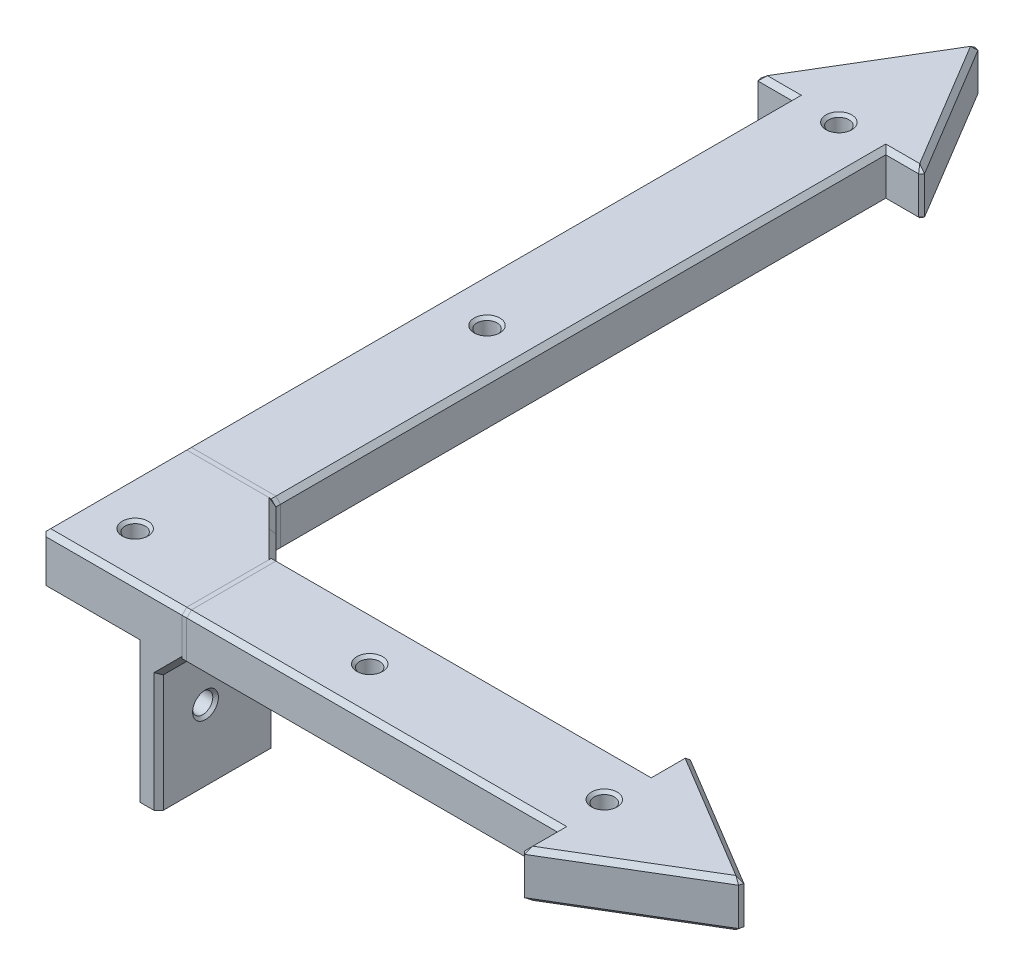
from build123d import *

# Parameters (mm, degrees)
BOSS_EXTRUDE1_DEPTH   = 10
SKETCH2_R             = 2.15
CUT_EXTRUDE1_DEPTH    = 223.261107709
BOSS_EXTRUDE5_DEPTH   = 10
BOSS_EXTRUDE6_DEPTH   = 30
SKETCH4_R             = 2.15
CUT_EXTRUDE2_DEPTH    = 217.10182785
SKETCH5_R             = 2.15
CUT_EXTRUDE3_DEPTH    = 219.403296678
SKETCH6_R             = 5
CUT_EXTRUDE4_DEPTH    = 6
CHAMFER1_SIZE         = 5
SKETCH9_W             = 20
SKETCH9_H             = 1
SKETCH9_W_2           = 1
SKETCH9_H_2           = 20
CUT_EXTRUDE5_DEPTH    = 226.610283454
SKETCH9_2_W           = 20
SKETCH9_2_H           = 1
BOSS_EXTRUDE7_DEPTH   = 10
SKETCH9_2_W_2         = 1
SKETCH9_2_H_2         = 20
BOSS_EXTRUDE7_2_DEPTH = 10
CHAMFER3_SIZE         = 1
CHAMFER4_SIZE         = 1
CHAMFER5_SIZE         = 1
CHAMFER7_SIZE         = 1
SKETCH10_R            = 5
CUT_EXTRUDE6_DEPTH    = 6
CHAMFER8_SIZE         = 1
CHAMFER9_SIZE         = 1
CHAMFER10_SIZE        = 0.6
CHAMFER11_SIZE        = 1
CHAMFER12_SIZE        = 1
CHAMFER13_SIZE        = 1
CHAMFER14_SIZE        = 1
CHAMFER15_SIZE        = 0.6
CHAMFER16_SIZE        = 0.6
CHAMFER17_SIZE        = 0.6


with BuildPart() as part:
    # Sketch1 → Boss-Extrude1 (new body)
    with BuildSketch(Plane(origin=(0, 0, 0), x_dir=(1, 0, 0), z_dir=(0, 1, 0))):
        Polygon((10, 150), (10, 10), (100, 10), (100, 18), (130, 0), (100, -18), (100, -10), (-10, -10), (-10, 150), (-18, 150), (0, 180), (18, 150), align=None)
    extrude(amount=BOSS_EXTRUDE1_DEPTH)

    # Sketch2 → Cut-Extrude1 (cut, through all)
    with BuildSketch(Plane(origin=(0, 10, 0), x_dir=(1, 0, 0), z_dir=(0, 1, 0))):
        with Locations(Location((0, 150, 0), (0, 0, 270))):
            Circle(SKETCH2_R)
        with Locations(Location((100, 0, 0), (0, 0, 270))):
            Circle(SKETCH2_R)
        with Locations(Location((0, 0, 0), (0, 0, 270))):
            Circle(SKETCH2_R)
        with Locations(Location((0, 75, 0), (0, 0, 270))):
            Circle(SKETCH2_R)
        with Locations(Location((50, 0, 0), (0, 0, 270))):
            Circle(SKETCH2_R)
    extrude(amount=-CUT_EXTRUDE1_DEPTH, mode=Mode.SUBTRACT)

    # Sketch3 → Boss-Extrude5 (add)
    with BuildSketch(Plane.XZ):
        Polygon((10, 10), (15, 10), (15, -15), (-10, -15), (-10, -10), (10, -10), align=None)
    extrude(amount=-BOSS_EXTRUDE5_DEPTH)

    # Sketch3<3> → Boss-Extrude6 (add)
    with BuildSketch(Plane.XZ):
        Polygon((10, 10), (15, 10), (15, -15), (-10, -15), (-10, -10), (10, -10), align=None)
    extrude(amount=BOSS_EXTRUDE6_DEPTH)

    # Sketch4 → Cut-Extrude2 (cut, through all)
    with BuildSketch(Plane.XY.offset(-10)):
        with Locations((0, -15)):
            Circle(SKETCH4_R)
    extrude(amount=-CUT_EXTRUDE2_DEPTH, mode=Mode.SUBTRACT)

    # Sketch5 → Cut-Extrude3 (cut, through all)
    with BuildSketch(Plane.ZY.offset(-10)):
        with Locations((0, -15)):
            Circle(SKETCH5_R)
    extrude(amount=-CUT_EXTRUDE3_DEPTH, mode=Mode.SUBTRACT)

    # Sketch6 → Cut-Extrude4 (cut)
    with BuildSketch(Plane.XZ):
        with Locations(Location((0, 0, 0), (0, 0, 270))):
            Circle(SKETCH6_R)
    extrude(amount=-CUT_EXTRUDE4_DEPTH, mode=Mode.SUBTRACT)

    # Chamfer1
    # the kernel refuses this chamfer: 5 mm, written as the material it adds along each edge
    with BuildSketch(Plane(origin=(10, 0, -15), x_dir=(0, 0.02749587661058634, -0.9996219169112968), z_dir=(-1, 0, 0))) as chamfer1_piece_1:
        Polygon((CHAMFER1_SIZE * 0.999621916911, CHAMFER1_SIZE * 0.0274958766106), (-CHAMFER1_SIZE * 0.0274958766106, CHAMFER1_SIZE * 0.999621916911), (0, 0), align=None)
    extrude(amount=20)
    with BuildSketch(Plane(origin=(10, 10, -15), x_dir=(-0.02749587661058631, 0, -0.9996219169112968), z_dir=(0, -1, 0))) as chamfer1_piece_2_section:
        Polygon((CHAMFER1_SIZE * 0.999621916911, CHAMFER1_SIZE * 0.0274958766106), (-CHAMFER1_SIZE * 0.0274958766106, CHAMFER1_SIZE * 0.999621916911), (0, 0), align=None)
    chamfer1_piece_2 = extrude(amount=10, mode=Mode.PRIVATE)
    chamfer1_piece_2 = split(chamfer1_piece_2, bisect_by=Plane(origin=(15, 5, -16.652020772), z_dir=(-1, 0, 0)), keep=Keep.TOP, mode=Mode.PRIVATE)
    add(chamfer1_piece_2)
    with BuildSketch(Plane(origin=(15, 0, -10), x_dir=(-0.02749587661058631, 0, -0.9996219169112968), z_dir=(0, 1, 0))) as chamfer1_piece_3_section:
        Polygon((CHAMFER1_SIZE * 0.999621916911, -CHAMFER1_SIZE * 0.0274958766106), (-CHAMFER1_SIZE * 0.0274958766106, -CHAMFER1_SIZE * 0.999621916911), (0, 0), align=None)
    chamfer1_piece_3 = extrude(amount=10, mode=Mode.PRIVATE)
    chamfer1_piece_3 = split(chamfer1_piece_3, bisect_by=Plane(origin=(16.652020772, 5, -15), z_dir=(0, 0, 1)), keep=Keep.TOP, mode=Mode.PRIVATE)
    add(chamfer1_piece_3)
    with BuildSketch(Plane(origin=(15, 0, 10), x_dir=(-0.027495876610586317, -0.9996219169112968, 0), z_dir=(0, 0, -1))) as chamfer1_piece_4:
        Polygon((CHAMFER1_SIZE * 0.999621916911, -CHAMFER1_SIZE * 0.0274958766106), (-CHAMFER1_SIZE * 0.0274958766106, -CHAMFER1_SIZE * 0.999621916911), (0, 0), align=None)
    extrude(amount=20)
    with BuildSketch(Plane(origin=(10, 10, -15), x_dir=(-0.02749587661058631, 0, -0.9996219169112968), z_dir=(0, -1, 0))) as chamfer1_piece_5a_section:
        Polygon((CHAMFER1_SIZE * 0.999621916911, CHAMFER1_SIZE * 0.0274958766106), (-CHAMFER1_SIZE * 0.0274958766106, CHAMFER1_SIZE * 0.999621916911), (0, 0), align=None)
    chamfer1_piece_5a = extrude(amount=22.85841494, mode=Mode.PRIVATE)
    chamfer1_piece_5a = split(chamfer1_piece_5a, bisect_by=Plane(origin=(11.643171669, 0, -16.652020772), z_dir=(0, -1, 0)), keep=Keep.TOP, mode=Mode.PRIVATE)
    chamfer1_piece_5a = split(chamfer1_piece_5a, bisect_by=Plane(origin=(15, -6.42920747, -16.652020772), z_dir=(-1, 0, 0)), keep=Keep.TOP, mode=Mode.PRIVATE)
    with BuildSketch(Plane(origin=(22.85841494, 0, -15), x_dir=(0, 0.027495876610586372, -0.9996219169112968), z_dir=(-1, 0, 0))) as chamfer1_piece_5b_section:
        Polygon((CHAMFER1_SIZE * 0.999621916911, CHAMFER1_SIZE * 0.0274958766106), (-CHAMFER1_SIZE * 0.0274958766106, CHAMFER1_SIZE * 0.999621916911), (0, 0), align=None)
    chamfer1_piece_5b = extrude(amount=32.85841494, mode=Mode.PRIVATE)
    chamfer1_piece_5b = split(chamfer1_piece_5b, bisect_by=Plane(origin=(10, -1.648968134, -16.648968134), z_dir=(1, 0, 0)), keep=Keep.TOP, mode=Mode.PRIVATE)
    chamfer1_piece_5b = split(chamfer1_piece_5b, bisect_by=Plane(origin=(15, -1.648968134, -16.648968134), z_dir=(-1, 0, 0)), keep=Keep.TOP, mode=Mode.PRIVATE)
    chamfer1_piece_5 = chamfer1_piece_5a & chamfer1_piece_5b
    add(chamfer1_piece_5)
    with BuildSketch(Plane(origin=(15, -12.85841494, -10), x_dir=(-0.027495876610586317, 0, -0.9996219169112968), z_dir=(0, 1, 0))) as chamfer1_piece_6a_section:
        Polygon((CHAMFER1_SIZE * 0.999621916911, -CHAMFER1_SIZE * 0.0274958766106), (-CHAMFER1_SIZE * 0.0274958766106, -CHAMFER1_SIZE * 0.999621916911), (0, 0), align=None)
    chamfer1_piece_6a = extrude(amount=22.85841494, mode=Mode.PRIVATE)
    chamfer1_piece_6a = split(chamfer1_piece_6a, bisect_by=Plane(origin=(16.652020772, -6.42920747, -15), z_dir=(0, 0, 1)), keep=Keep.TOP, mode=Mode.PRIVATE)
    chamfer1_piece_6a = split(chamfer1_piece_6a, bisect_by=Plane(origin=(16.652020772, 0, -11.643171669), z_dir=(0, -1, 0)), keep=Keep.TOP, mode=Mode.PRIVATE)
    with BuildSketch(Plane(origin=(15, 0, 10), x_dir=(-0.027495876610586317, -0.9996219169112968, 0), z_dir=(0, 0, -1))) as chamfer1_piece_6b_section:
        Polygon((CHAMFER1_SIZE * 0.999621916911, -CHAMFER1_SIZE * 0.0274958766106), (-CHAMFER1_SIZE * 0.0274958766106, -CHAMFER1_SIZE * 0.999621916911), (0, 0), align=None)
    chamfer1_piece_6b = extrude(amount=32.85841494, mode=Mode.PRIVATE)
    chamfer1_piece_6b = split(chamfer1_piece_6b, bisect_by=Plane(origin=(16.648968134, -1.648968134, -15), z_dir=(0, 0, 1)), keep=Keep.TOP, mode=Mode.PRIVATE)
    chamfer1_piece_6b = split(chamfer1_piece_6b, bisect_by=Plane(origin=(16.648968134, -1.648968134, -10), z_dir=(0, 0, -1)), keep=Keep.TOP, mode=Mode.PRIVATE)
    chamfer1_piece_6 = chamfer1_piece_6a & chamfer1_piece_6b
    add(chamfer1_piece_6)

    # Sketch9 → Cut-Extrude5 (cut, through all)
    with BuildSketch(Plane(origin=(0, 10, 0), x_dir=(1, 0, 0), z_dir=(0, 1, 0))):
        with Locations((0, 20.5)):
            Rectangle(SKETCH9_W, SKETCH9_H)
        with Locations((20.5, 0)):
            Rectangle(SKETCH9_W_2, SKETCH9_H_2)
    extrude(amount=-CUT_EXTRUDE5_DEPTH, mode=Mode.SUBTRACT)


with BuildPart() as cut_extrude5_piece_1:
    # of the separate pieces the step leaves, piece 1, a body of its own (cut_extrude5_pieces)
    add(part.part.solids().sort_by_distance((10, 0, -150))[0])

    # Chamfer2
    # the kernel refuses this chamfer: 1, 0.739130435, 0.728868987 mm, written as the material it takes off along each edge
    with BuildSketch(Plane(origin=(-16.99681496, 9.333333333, -150.619164309), x_dir=(-0.7782088562567454, -0.6217242142135965, 0.08860009878128813), z_dir=(-0.6063729082177826, 0.7805968163467781, 0.15159322705445322))) as chamfer2_piece_1:
        Polygon((-1.042002401, -0.293067246), (0.566427795, -0.293067246), (0.475574606, 0.586134493), align=None)
    extrude(amount=1.344819546, mode=Mode.SUBTRACT)
    with BuildSketch(Plane(origin=(0.044738761, 9.333333333, -178.855019108), x_dir=(0.32907259085720125, -0.6396021490668314, -0.6947088029207775), z_dir=(0.15691973428976674, 0.7624928516630223, -0.627678937159135))) as chamfer2_piece_2:
        Polygon((-0.995966631, -0.303924041), (0.567505288, -0.303924041), (0.428461343, 0.607848083), align=None)
    extrude(amount=1.341987419, mode=Mode.SUBTRACT)
    with BuildSketch(Plane(origin=(-16.99681496, 0.666666667, -150.619164309), x_dir=(-0.7782088562567492, 0.6217242142135969, 0.08860009878125295), z_dir=(-0.6063729082177852, -0.780596816346776, 0.15159322705445313))) as chamfer2_piece_3:
        Polygon((-1.042002401, 0.293067246), (0.566427795, 0.293067246), (0.475574606, -0.586134493), align=None)
    extrude(amount=1.344819546, mode=Mode.SUBTRACT)
    with BuildSketch(Plane(origin=(0.044738761, 0.666666667, -178.855019108), x_dir=(0.32907259085719187, 0.6396021490668234, -0.6947088029207894), z_dir=(0.15691973428976302, -0.7624928516630299, -0.6276789371591265))) as chamfer2_piece_4:
        Polygon((-0.995966631, 0.303924041), (0.567505288, 0.303924041), (0.428461343, -0.607848083), align=None)
    extrude(amount=1.341987419, mode=Mode.SUBTRACT)
    with BuildSketch(Plane(origin=(16.95293654, 0.666666667, -150.541666667), x_dir=(-0.4763591113025611, -0.621724214213599, -0.6217242142135991), z_dir=(0.4419664072694202, -0.7805968163467748, 0.4419664072694219))) as chamfer2_piece_5:
        Polygon((-0.566427795, -0.293067246), (1.042002401, -0.293067246), (-0.475574606, 0.586134493), align=None)
    extrude(amount=1.344819546, mode=Mode.SUBTRACT)
    with BuildSketch(Plane(origin=(16.95293654, 9.333333333, -150.541666667), x_dir=(-0.47635911130255404, 0.6217242142135928, -0.6217242142136105), z_dir=(0.4419664072694172, 0.780596816346779, 0.4419664072694175))) as chamfer2_piece_6:
        Polygon((-0.566427795, 0.293067246), (1.042002401, 0.293067246), (-0.475574606, -0.586134493), align=None)
    extrude(amount=1.344819546, mode=Mode.SUBTRACT)
    with BuildSketch(Plane(origin=(-19.323119982, 10, -147.794800031), x_dir=(0.8571687221386496, 0.027495876610585782, 0.5143012332831899), z_dir=(0.5144957554275266, 0, -0.8574929257125442)), Plane(origin=(-1.323119982, 10, -182.205199969), x_dir=(-0.8571687221386496, 0.027495876610585723, 0.5143012332831898), z_dir=(0.5144957554275266, 0, 0.8574929257125442))) as chamfer2_piece_7:
        with BuildLine():
            Line((1.028673195, 0), (-0.056547155, 1.027117794))
            Line((-0.056547155, 1.027117794), (-0.076539593, 1.026567876))
            ThreePointArc((-0.076539593, 1.026567876), (-0.034129227, 0.51339783), (-0.019992438, -0.000549918))
            Line((-0.019992438, -0.000549918), (0.000549918, -0.019992438))
            ThreePointArc((0.000549918, -0.019992438), (0.514497665, -0.00585565), (1.029223113, -0.019992438))
            Line((1.029223113, -0.019992438), (1.028673195, 0))
        make_face()
    extrude(amount=40.129077345, mode=Mode.SUBTRACT)
    with BuildSketch(Plane(origin=(-10, 0, -18.428317012), x_dir=(0.9996219169112968, -0.027495876610586355, 0), z_dir=(0, 0, -1)), Plane(origin=(10, 10, -150), x_dir=(0.02749587661058574, -0.9996219169112968, 0), z_dir=(0, 0, 1)), Plane(origin=(-10, 10, -150), x_dir=(0.9996219169112968, 0.027495876610585647, 0), z_dir=(0, 0, 1))) as chamfer2_piece_8:
        with BuildLine():
            Line((1.028673195, 0), (-0.056547155, -1.027117794))
            Line((-0.056547155, -1.027117794), (-0.076539593, -1.026567876))
            ThreePointArc((-0.076539593, -1.026567876), (-0.034129227, -0.51339783), (-0.019992438, 0.000549918))
            Line((-0.019992438, 0.000549918), (0.000549918, 0.019992438))
            ThreePointArc((0.000549918, 0.019992438), (0.514497665, 0.00585565), (1.029223113, 0.019992438))
            Line((1.029223113, 0.019992438), (1.028673195, 0))
        make_face()
    extrude(amount=131.571682988, mode=Mode.SUBTRACT)
    with BuildSketch(Plane(origin=(-10, 0, -150), x_dir=(0, -0.027495876610586483, -0.9996219169112968), z_dir=(-1, 0, 0)), Plane(origin=(20.571682988, 10, -150), x_dir=(0, -0.999621916911297, 0.0274958766105822), z_dir=(-1, 0, 0))) as chamfer2_piece_9:
        with BuildLine():
            Line((1.028673195, 0), (-0.056547155, -1.027117794))
            Line((-0.056547155, -1.027117794), (-0.076539593, -1.026567876))
            ThreePointArc((-0.076539593, -1.026567876), (-0.034129227, -0.51339783), (-0.019992438, 0.000549918))
            Line((-0.019992438, 0.000549918), (0.000549918, 0.019992438))
            ThreePointArc((0.000549918, 0.019992438), (0.514497665, 0.00585565), (1.029223113, 0.019992438))
            Line((1.029223113, 0.019992438), (1.028673195, 0))
        make_face()
    extrude(amount=10.571682988, mode=Mode.SUBTRACT)
    with BuildSketch(Plane(origin=(-19.323119982, 0, -147.794800031), x_dir=(0.8571687221386495, -0.027495876610586, 0.5143012332831898), z_dir=(0.5144957554275266, 0, -0.8574929257125442)), Plane(origin=(-1.323119982, 0, -182.205199969), x_dir=(-0.8571687221386497, -0.02749587661058593, 0.5143012332831898), z_dir=(0.5144957554275266, 0, 0.8574929257125442))) as chamfer2_piece_10:
        with BuildLine():
            Line((1.028673195, 0), (-0.056547155, -1.027117794))
            Line((-0.056547155, -1.027117794), (-0.076539593, -1.026567876))
            ThreePointArc((-0.076539593, -1.026567876), (-0.034129227, -0.51339783), (-0.019992438, 0.000549918))
            Line((-0.019992438, 0.000549918), (0.000549918, 0.019992438))
            ThreePointArc((0.000549918, 0.019992438), (0.514497665, 0.00585565), (1.029223113, 0.019992438))
            Line((1.029223113, 0.019992438), (1.028673195, 0))
        make_face()
    extrude(amount=40.129077345, mode=Mode.SUBTRACT)
    with BuildSketch(Plane(origin=(10, 0, -150), x_dir=(0.0274958766105856, 0.9996219169112968, 0), z_dir=(0, 0, 1))) as chamfer2_piece_11:
        with BuildLine():
            Line((1.028673195, 0), (-0.056547155, 1.027117794))
            Line((-0.056547155, 1.027117794), (-0.076539593, 1.026567876))
            ThreePointArc((-0.076539593, 1.026567876), (-0.034129227, 0.51339783), (-0.019992438, -0.000549918))
            Line((-0.019992438, -0.000549918), (0.000549918, -0.019992438))
            ThreePointArc((0.000549918, -0.019992438), (0.514497665, -0.00585565), (1.029223113, -0.019992438))
            Line((1.029223113, -0.019992438), (1.028673195, 0))
        make_face()
    extrude(amount=131.571682988, mode=Mode.SUBTRACT)
    with BuildSketch(Plane(origin=(20.571682988, 0, -150), x_dir=(0, 0.999621916911297, 0.02749587661058218), z_dir=(-1, 0, 0)), Plane(origin=(-10, 10, -150), x_dir=(0, 0.02749587661058422, -0.9996219169112968), z_dir=(-1, 0, 0))) as chamfer2_piece_12:
        with BuildLine():
            Line((1.028673195, 0), (-0.056547155, 1.027117794))
            Line((-0.056547155, 1.027117794), (-0.076539593, 1.026567876))
            ThreePointArc((-0.076539593, 1.026567876), (-0.034129227, 0.51339783), (-0.019992438, -0.000549918))
            Line((-0.019992438, -0.000549918), (0.000549918, -0.019992438))
            ThreePointArc((0.000549918, -0.019992438), (0.514497665, -0.00585565), (1.029223113, -0.019992438))
            Line((1.029223113, -0.019992438), (1.028673195, 0))
        make_face()
    extrude(amount=10.571682988, mode=Mode.SUBTRACT)
    with BuildSketch(Plane(origin=(-18, -2.571682988, -150), x_dir=(0.49072371360334666, 0, -0.8713152339465554), z_dir=(0, 1, 0)), Plane(origin=(18, -2.571682988, -150), x_dir=(-0.999621916911297, 0, 0.0274958766105822), z_dir=(0, 1, 0))) as chamfer2_piece_13:
        with BuildLine():
            Line((1.028673195, 0), (0.328622018, -0.662570528))
            Line((0.328622018, -0.662570528), (0.311195713, -0.672385003))
            ThreePointArc((0.311195713, -0.672385003), (0.163790703, -0.3315783), (-0.017426305, -0.009814474))
            Line((-0.017426305, -0.009814474), (0.000549918, 0.019992438))
            ThreePointArc((0.000549918, 0.019992438), (0.514497665, 0.00585565), (1.029223113, 0.019992438))
            Line((1.029223113, 0.019992438), (1.028673195, 0))
        make_face()
    extrude(amount=15.143365976, mode=Mode.SUBTRACT)
    with BuildSketch(Plane(origin=(0, -2.571682988, -180), x_dir=(0.5378787529630349, 0, 0.8430222103307425), z_dir=(0, 1, 0))) as chamfer2_piece_14:
        with BuildLine():
            Line((1.028673195, 0), (0.300711208, -0.688986997))
            Line((0.300711208, -0.688986997), (0.282812037, -0.697909982))
            ThreePointArc((0.282812037, -0.697909982), (0.149580102, -0.344880097), (-0.017899171, -0.008922985))
            Line((-0.017899171, -0.008922985), (0.000549918, 0.019992438))
            ThreePointArc((0.000549918, 0.019992438), (0.514497665, 0.00585565), (1.029223113, 0.019992438))
            Line((1.029223113, 0.019992438), (1.028673195, 0))
        make_face()
    extrude(amount=15.143365976, mode=Mode.SUBTRACT)
    with BuildSketch(Plane(origin=(-7.428317012, 0, -150), x_dir=(0, -0.027495876610586483, -0.9996219169112968), z_dir=(-1, 0, 0))) as chamfer2_piece_15a_section:
        with BuildLine():
            Line((1.028673195, 0), (-0.056547155, -1.027117794))
            Line((-0.056547155, -1.027117794), (-0.076539593, -1.026567876))
            ThreePointArc((-0.076539593, -1.026567876), (-0.034129227, -0.51339783), (-0.019992438, 0.000549918))
            Line((-0.019992438, 0.000549918), (0.000549918, 0.019992438))
            ThreePointArc((0.000549918, 0.019992438), (0.514497665, 0.00585565), (1.029223113, 0.019992438))
            Line((1.029223113, 0.019992438), (1.028673195, 0))
        make_face()
    chamfer2_piece_15a = extrude(amount=13.143365976, mode=Mode.PRIVATE)
    chamfer2_piece_15a = split(chamfer2_piece_15a, bisect_by=Plane(origin=(-10, 0.329793627, -150.329793627), z_dir=(1, 0, 0)), keep=Keep.TOP, mode=Mode.PRIVATE)
    with BuildSketch(Plane(origin=(-10, 0, -18.428317012), x_dir=(0.9996219169112968, -0.027495876610586355, 0), z_dir=(0, 0, -1))) as chamfer2_piece_15b_section:
        with BuildLine():
            Line((1.028673195, 0), (-0.056547155, -1.027117794))
            Line((-0.056547155, -1.027117794), (-0.076539593, -1.026567876))
            ThreePointArc((-0.076539593, -1.026567876), (-0.034129227, -0.51339783), (-0.019992438, 0.000549918))
            Line((-0.019992438, 0.000549918), (0.000549918, 0.019992438))
            ThreePointArc((0.000549918, 0.019992438), (0.514497665, 0.00585565), (1.029223113, 0.019992438))
            Line((1.029223113, 0.019992438), (1.028673195, 0))
        make_face()
    chamfer2_piece_15b = extrude(amount=134.143365976, mode=Mode.PRIVATE)
    chamfer2_piece_15b = split(chamfer2_piece_15b, bisect_by=Plane(origin=(-9.670206373, 0.329793627, -150), z_dir=(0, 0, -1)), keep=Keep.TOP, mode=Mode.PRIVATE)
    chamfer2_piece_15 = chamfer2_piece_15a & chamfer2_piece_15b
    add(chamfer2_piece_15, mode=Mode.SUBTRACT)
    with BuildSketch(Plane(origin=(10, 10, -152.571682988), x_dir=(0.02749587661058574, -0.9996219169112968, 0), z_dir=(0, 0, 1))) as chamfer2_piece_16a_section:
        with BuildLine():
            Line((1.028673195, 0), (-0.056547155, -1.027117794))
            Line((-0.056547155, -1.027117794), (-0.076539593, -1.026567876))
            ThreePointArc((-0.076539593, -1.026567876), (-0.034129227, -0.51339783), (-0.019992438, 0.000549918))
            Line((-0.019992438, 0.000549918), (0.000549918, 0.019992438))
            ThreePointArc((0.000549918, 0.019992438), (0.514497665, 0.00585565), (1.029223113, 0.019992438))
            Line((1.029223113, 0.019992438), (1.028673195, 0))
        make_face()
    chamfer2_piece_16a = extrude(amount=134.143365976, mode=Mode.PRIVATE)
    chamfer2_piece_16a = split(chamfer2_piece_16a, bisect_by=Plane(origin=(9.670206373, 9.670206373, -150), z_dir=(0, 0, -1)), keep=Keep.TOP, mode=Mode.PRIVATE)
    with BuildSketch(Plane(origin=(20.571682988, 10, -150), x_dir=(0, -0.999621916911297, 0.0274958766105822), z_dir=(-1, 0, 0))) as chamfer2_piece_16b_section:
        with BuildLine():
            Line((1.028673195, 0), (-0.056547155, -1.027117794))
            Line((-0.056547155, -1.027117794), (-0.076539593, -1.026567876))
            ThreePointArc((-0.076539593, -1.026567876), (-0.034129227, -0.51339783), (-0.019992438, 0.000549918))
            Line((-0.019992438, 0.000549918), (0.000549918, 0.019992438))
            ThreePointArc((0.000549918, 0.019992438), (0.514497665, 0.00585565), (1.029223113, 0.019992438))
            Line((1.029223113, 0.019992438), (1.028673195, 0))
        make_face()
    chamfer2_piece_16b = extrude(amount=13.143365976, mode=Mode.PRIVATE)
    chamfer2_piece_16b = split(chamfer2_piece_16b, bisect_by=Plane(origin=(10, 9.670206373, -150.329793627), z_dir=(-1, 0, 0)), keep=Keep.TOP, mode=Mode.PRIVATE)
    chamfer2_piece_16 = chamfer2_piece_16a & chamfer2_piece_16b
    add(chamfer2_piece_16, mode=Mode.SUBTRACT)
    with BuildSketch(Plane(origin=(10, 0, -152.571682988), x_dir=(0.027495876610585623, 0.9996219169112968, 0), z_dir=(0, 0, 1))) as chamfer2_piece_17a_section:
        with BuildLine():
            Line((1.028673195, 0), (-0.056547155, 1.027117794))
            Line((-0.056547155, 1.027117794), (-0.076539593, 1.026567876))
            ThreePointArc((-0.076539593, 1.026567876), (-0.034129227, 0.51339783), (-0.019992438, -0.000549918))
            Line((-0.019992438, -0.000549918), (0.000549918, -0.019992438))
            ThreePointArc((0.000549918, -0.019992438), (0.514497665, -0.00585565), (1.029223113, -0.019992438))
            Line((1.029223113, -0.019992438), (1.028673195, 0))
        make_face()
    chamfer2_piece_17a = extrude(amount=134.143365976, mode=Mode.PRIVATE)
    chamfer2_piece_17a = split(chamfer2_piece_17a, bisect_by=Plane(origin=(9.670206373, 0.329793627, -150), z_dir=(0, 0, -1)), keep=Keep.TOP, mode=Mode.PRIVATE)
    with BuildSketch(Plane(origin=(20.571682988, 0, -150), x_dir=(0, 0.999621916911297, 0.02749587661058218), z_dir=(-1, 0, 0))) as chamfer2_piece_17b_section:
        with BuildLine():
            Line((1.028673195, 0), (-0.056547155, 1.027117794))
            Line((-0.056547155, 1.027117794), (-0.076539593, 1.026567876))
            ThreePointArc((-0.076539593, 1.026567876), (-0.034129227, 0.51339783), (-0.019992438, -0.000549918))
            Line((-0.019992438, -0.000549918), (0.000549918, -0.019992438))
            ThreePointArc((0.000549918, -0.019992438), (0.514497665, -0.00585565), (1.029223113, -0.019992438))
            Line((1.029223113, -0.019992438), (1.028673195, 0))
        make_face()
    chamfer2_piece_17b = extrude(amount=13.143365976, mode=Mode.PRIVATE)
    chamfer2_piece_17b = split(chamfer2_piece_17b, bisect_by=Plane(origin=(10, 0.329793627, -150.329793627), z_dir=(-1, 0, 0)), keep=Keep.TOP, mode=Mode.PRIVATE)
    chamfer2_piece_17 = chamfer2_piece_17a & chamfer2_piece_17b
    add(chamfer2_piece_17, mode=Mode.SUBTRACT)
    with BuildSketch(Plane(origin=(-7.428317012, 10, -150), x_dir=(0, 0.02749587661058422, -0.9996219169112968), z_dir=(-1, 0, 0))) as chamfer2_piece_18a_section:
        with BuildLine():
            Line((1.028673195, 0), (-0.056547155, 1.027117794))
            Line((-0.056547155, 1.027117794), (-0.076539593, 1.026567876))
            ThreePointArc((-0.076539593, 1.026567876), (-0.034129227, 0.51339783), (-0.019992438, -0.000549918))
            Line((-0.019992438, -0.000549918), (0.000549918, -0.019992438))
            ThreePointArc((0.000549918, -0.019992438), (0.514497665, -0.00585565), (1.029223113, -0.019992438))
            Line((1.029223113, -0.019992438), (1.028673195, 0))
        make_face()
    chamfer2_piece_18a = extrude(amount=13.143365976, mode=Mode.PRIVATE)
    chamfer2_piece_18a = split(chamfer2_piece_18a, bisect_by=Plane(origin=(-10, 9.670206373, -150.329793627), z_dir=(1, 0, 0)), keep=Keep.TOP, mode=Mode.PRIVATE)
    with BuildSketch(Plane(origin=(-10, 10, -152.571682988), x_dir=(0.9996219169112968, 0.02749587661058574, 0), z_dir=(0, 0, 1))) as chamfer2_piece_18b_section:
        with BuildLine():
            Line((1.028673195, 0), (-0.056547155, -1.027117794))
            Line((-0.056547155, -1.027117794), (-0.076539593, -1.026567876))
            ThreePointArc((-0.076539593, -1.026567876), (-0.034129227, -0.51339783), (-0.019992438, 0.000549918))
            Line((-0.019992438, 0.000549918), (0.000549918, 0.019992438))
            ThreePointArc((0.000549918, 0.019992438), (0.514497665, 0.00585565), (1.029223113, 0.019992438))
            Line((1.029223113, 0.019992438), (1.028673195, 0))
        make_face()
    chamfer2_piece_18b = extrude(amount=134.143365976, mode=Mode.PRIVATE)
    chamfer2_piece_18b = split(chamfer2_piece_18b, bisect_by=Plane(origin=(-9.670206373, 9.670206373, -150), z_dir=(0, 0, -1)), keep=Keep.TOP, mode=Mode.PRIVATE)
    chamfer2_piece_18 = chamfer2_piece_18a & chamfer2_piece_18b
    add(chamfer2_piece_18, mode=Mode.SUBTRACT)


with BuildPart() as cut_extrude5_piece_2:
    # of the separate pieces the step leaves, piece 2, a body of its own (cut_extrude5_pieces)
    add(part.part.solids().sort_by_distance((21, 0, -10))[0])

    # Chamfer6
    # the kernel refuses this chamfer: 1, 0.739130435, 0.728868987 mm, written as the material it takes off along each edge
    with BuildSketch(Plane(origin=(100.619164309, 0.666666667, -16.99681496), x_dir=(0.08860009878125359, -0.621724214213601, 0.7782088562567459), z_dir=(-0.15159322705444028, -0.7805968163467738, -0.6063729082177913))) as chamfer6_piece_1:
        Polygon((-0.566427795, -0.293067246), (1.042002401, -0.293067246), (-0.475574606, 0.586134493), align=None)
    extrude(amount=1.344819546, mode=Mode.SUBTRACT)
    with BuildSketch(Plane(origin=(128.855019108, 0.666666667, 0.044738761), x_dir=(-0.7744876408886496, -0.5912789605787493, 0.22485125058057331), z_dir=(0.6276789371591284, -0.7624928516630249, 0.1569197342897806))) as chamfer6_piece_2:
        Polygon((-0.688562834, 0.280961988), (1.00268625, 0.280961988), (-0.314123416, -0.561923976), align=None)
    extrude(amount=1.341987419, mode=Mode.SUBTRACT)
    with BuildSketch(Plane(origin=(100.541666667, 0.666666667, 16.95293654), x_dir=(-0.6217242142136105, 0.6217242142135928, 0.47635911130255404), z_dir=(-0.44196640726941855, -0.7805968163467791, 0.441966407269416))) as chamfer6_piece_3:
        Polygon((-1.042002401, 0.293067246), (0.566427795, 0.293067246), (0.475574606, -0.586134493), align=None)
    extrude(amount=1.344819546, mode=Mode.SUBTRACT)
    with BuildSketch(Plane(origin=(100.541666667, 9.333333333, 16.95293654), x_dir=(-0.6217242142136105, -0.6217242142135928, 0.47635911130255404), z_dir=(-0.44196640726941855, 0.7805968163467791, 0.441966407269416))) as chamfer6_piece_4:
        Polygon((-1.042002401, -0.293067246), (0.566427795, -0.293067246), (0.475574606, 0.586134493), align=None)
    extrude(amount=1.344819546, mode=Mode.SUBTRACT)
    with BuildSketch(Plane(origin=(128.855019108, 9.333333333, 0.044738761), x_dir=(-0.7744876408886497, 0.5912789605787492, 0.22485125058057354), z_dir=(0.6276789371591281, 0.7624928516630249, 0.15691973428978054))) as chamfer6_piece_5:
        Polygon((-0.688562834, -0.280961988), (1.00268625, -0.280961988), (-0.314123416, 0.561923976), align=None)
    extrude(amount=1.341987419, mode=Mode.SUBTRACT)
    with BuildSketch(Plane(origin=(100.619164309, 9.333333333, -16.99681496), x_dir=(-0.9701425001453348, 0, 0.24253562503632162), z_dir=(-0.15159322705444056, 0.7805968163467729, -0.6063729082177924))) as chamfer6_piece_6:
        Polygon((-0.349737282, -0.533303565), (0.534146195, -0.533303565), (-0.184408913, 1.066607129), align=None)
    extrude(amount=1.344819546, mode=Mode.SUBTRACT)
    with BuildSketch(Plane(origin=(100, 0, -10), x_dir=(0.9996219169112968, -0.027495876610586483, 0), z_dir=(0, 0, -1)), Plane(origin=(100, 0, 20.571682988), x_dir=(0.9996219169112968, -0.027495876610585335, 0), z_dir=(0, 0, -1)), Plane(origin=(100, 10, -10), x_dir=(-0.0274958766105822, -0.999621916911297, 0), z_dir=(0, 0, -1))) as chamfer6_piece_7:
        with BuildLine():
            Line((1.028673195, 0), (-0.056547155, -1.027117794))
            Line((-0.056547155, -1.027117794), (-0.076539593, -1.026567876))
            ThreePointArc((-0.076539593, -1.026567876), (-0.034129227, -0.51339783), (-0.019992438, 0.000549918))
            Line((-0.019992438, 0.000549918), (0.000549918, 0.019992438))
            ThreePointArc((0.000549918, 0.019992438), (0.514497665, 0.00585565), (1.029223113, 0.019992438))
            Line((1.029223113, 0.019992438), (1.028673195, 0))
        make_face()
    extrude(amount=10.571682988, mode=Mode.SUBTRACT)
    with BuildSketch(Plane(origin=(97.794800031, 0, -19.323119982), x_dir=(-0.5143012332831898, -0.027495876610586768, 0.8571687221386495), z_dir=(0.8574929257125442, 0, 0.5144957554275266)), Plane(origin=(132.205199969, 0, -1.323119982), x_dir=(-0.5143012332831898, -0.027495876610586785, -0.8571687221386495), z_dir=(-0.8574929257125442, 0, 0.5144957554275266))) as chamfer6_piece_8:
        with BuildLine():
            Line((1.028673195, 0), (-0.056547155, -1.027117794))
            Line((-0.056547155, -1.027117794), (-0.076539593, -1.026567876))
            ThreePointArc((-0.076539593, -1.026567876), (-0.034129227, -0.51339783), (-0.019992438, 0.000549918))
            Line((-0.019992438, 0.000549918), (0.000549918, 0.019992438))
            ThreePointArc((0.000549918, 0.019992438), (0.514497665, 0.00585565), (1.029223113, 0.019992438))
            Line((1.029223113, 0.019992438), (1.028673195, 0))
        make_face()
    extrude(amount=40.129077345, mode=Mode.SUBTRACT)
    with BuildSketch(Plane(origin=(18.428317012, 10, 10), x_dir=(0, 0.027495876610585838, -0.9996219169112968), z_dir=(1, 0, 0)), Plane(origin=(18.428317012, 10, -10), x_dir=(0, -0.9996219169112968, -0.027495876610585647), z_dir=(1, 0, 0)), Plane(origin=(100, 0, 10), x_dir=(0, -0.027495876610586764, -0.9996219169112968), z_dir=(-1, 0, 0))) as chamfer6_piece_9:
        with BuildLine():
            Line((1.028673195, 0), (-0.056547155, -1.027117794))
            Line((-0.056547155, -1.027117794), (-0.076539593, -1.026567876))
            ThreePointArc((-0.076539593, -1.026567876), (-0.034129227, -0.51339783), (-0.019992438, 0.000549918))
            Line((-0.019992438, 0.000549918), (0.000549918, 0.019992438))
            ThreePointArc((0.000549918, 0.019992438), (0.514497665, 0.00585565), (1.029223113, 0.019992438))
            Line((1.029223113, 0.019992438), (1.028673195, 0))
        make_face()
    extrude(amount=81.571682988, mode=Mode.SUBTRACT)
    with BuildSketch(Plane(origin=(100, 10, 20.571682988), x_dir=(0.9996219169112968, 0.02749587661058498, 0), z_dir=(0, 0, -1))) as chamfer6_piece_10:
        with BuildLine():
            Line((1.028673195, 0), (-0.056547155, 1.027117794))
            Line((-0.056547155, 1.027117794), (-0.076539593, 1.026567876))
            ThreePointArc((-0.076539593, 1.026567876), (-0.034129227, 0.51339783), (-0.019992438, -0.000549918))
            Line((-0.019992438, -0.000549918), (0.000549918, -0.019992438))
            ThreePointArc((0.000549918, -0.019992438), (0.514497665, -0.00585565), (1.029223113, -0.019992438))
            Line((1.029223113, -0.019992438), (1.028673195, 0))
        make_face()
    extrude(amount=10.571682988, mode=Mode.SUBTRACT)
    with BuildSketch(Plane(origin=(132.205199969, 10, -1.323119982), x_dir=(-0.5143012332831898, 0.027495876610587538, -0.8571687221386495), z_dir=(-0.8574929257125442, 0, 0.5144957554275266)), Plane(origin=(97.794800031, 10, -19.323119982), x_dir=(-0.5143012332831898, 0.02749587661058762, 0.8571687221386495), z_dir=(0.8574929257125442, 0, 0.5144957554275266))) as chamfer6_piece_11:
        with BuildLine():
            Line((1.028673195, 0), (-0.056547155, 1.027117794))
            Line((-0.056547155, 1.027117794), (-0.076539593, 1.026567876))
            ThreePointArc((-0.076539593, 1.026567876), (-0.034129227, 0.51339783), (-0.019992438, -0.000549918))
            Line((-0.019992438, -0.000549918), (0.000549918, -0.019992438))
            ThreePointArc((0.000549918, -0.019992438), (0.514497665, -0.00585565), (1.029223113, -0.019992438))
            Line((1.029223113, -0.019992438), (1.028673195, 0))
        make_face()
    extrude(amount=40.129077345, mode=Mode.SUBTRACT)
    with BuildSketch(Plane(origin=(18.428317012, 0, -10), x_dir=(0, 0.9996219169112968, -0.02749587661058563), z_dir=(1, 0, 0))) as chamfer6_piece_12:
        with BuildLine():
            Line((1.028673195, 0), (-0.056547155, 1.027117794))
            Line((-0.056547155, 1.027117794), (-0.076539593, 1.026567876))
            ThreePointArc((-0.076539593, 1.026567876), (-0.034129227, 0.51339783), (-0.019992438, -0.000549918))
            Line((-0.019992438, -0.000549918), (0.000549918, -0.019992438))
            ThreePointArc((0.000549918, -0.019992438), (0.514497665, -0.00585565), (1.029223113, -0.019992438))
            Line((1.029223113, -0.019992438), (1.028673195, 0))
        make_face()
    extrude(amount=81.571682988, mode=Mode.SUBTRACT)
    with BuildSketch(Plane(origin=(100, -2.571682988, -18), x_dir=(-0.052469265030705134, 0, 0.9986225394147368), z_dir=(0, 1, 0))) as chamfer6_piece_13:
        with BuildLine():
            Line((0.739589167, 0), (0.457070866, 0.921550197))
            Line((0.457070866, 0.921550197), (0.439404726, 0.930926098))
            ThreePointArc((0.439404726, 0.930926098), (0.223361141, 0.463521236), (-0.01766614, 0.009375901))
            Line((-0.01766614, 0.009375901), (0.001049385, -0.019972451))
            ThreePointArc((0.001049385, -0.019972451), (0.369825915, -0.000596327), (0.740638552, -0.019972451))
            Line((0.740638552, -0.019972451), (0.739589167, 0))
        make_face()
    extrude(amount=15.143365976, mode=Mode.SUBTRACT)
    with BuildSketch(Plane(origin=(130, -2.571682988, 0), x_dir=(-0.8430222103307443, 0, 0.537878752963032), z_dir=(0, 1, 0))) as chamfer6_piece_14:
        with BuildLine():
            Line((1.028673195, 0), (0.300711208, -0.688986997))
            Line((0.300711208, -0.688986997), (0.282812037, -0.697909982))
            ThreePointArc((0.282812037, -0.697909982), (0.149580102, -0.344880097), (-0.017899171, -0.008922985))
            Line((-0.017899171, -0.008922985), (0.000549918, 0.019992438))
            ThreePointArc((0.000549918, 0.019992438), (0.514497665, 0.00585565), (1.029223113, 0.019992438))
            Line((1.029223113, 0.019992438), (1.028673195, 0))
        make_face()
    extrude(amount=15.143365976, mode=Mode.SUBTRACT)
    with BuildSketch(Plane(origin=(100, -2.571682988, 18), x_dir=(-0.0274958766105822, 0, -0.999621916911297), z_dir=(0, 1, 0))) as chamfer6_piece_15:
        with BuildLine():
            Line((1.028673195, 0), (0.328622018, -0.662570528))
            Line((0.328622018, -0.662570528), (0.311195713, -0.672385003))
            ThreePointArc((0.311195713, -0.672385003), (0.163790703, -0.3315783), (-0.017426305, -0.009814474))
            Line((-0.017426305, -0.009814474), (0.000549918, 0.019992438))
            ThreePointArc((0.000549918, 0.019992438), (0.514497665, 0.00585565), (1.029223113, 0.019992438))
            Line((1.029223113, 0.019992438), (1.028673195, 0))
        make_face()
    extrude(amount=15.143365976, mode=Mode.SUBTRACT)
    with BuildSketch(Plane(origin=(18.428317012, 0, -10), x_dir=(0, 0.9996219169112968, -0.02749587661058563), z_dir=(1, 0, 0))) as chamfer6_piece_16a_section:
        with BuildLine():
            Line((1.028673195, 0), (-0.056547155, 1.027117794))
            Line((-0.056547155, 1.027117794), (-0.076539593, 1.026567876))
            ThreePointArc((-0.076539593, 1.026567876), (-0.034129227, 0.51339783), (-0.019992438, -0.000549918))
            Line((-0.019992438, -0.000549918), (0.000549918, -0.019992438))
            ThreePointArc((0.000549918, -0.019992438), (0.514497665, -0.00585565), (1.029223113, -0.019992438))
            Line((1.029223113, -0.019992438), (1.028673195, 0))
        make_face()
    chamfer6_piece_16a = extrude(amount=84.143365976, mode=Mode.PRIVATE)
    chamfer6_piece_16a = split(chamfer6_piece_16a, bisect_by=Plane(origin=(100, 0.329793627, -9.670206373), z_dir=(1, 0, 0)), keep=Keep.TOP, mode=Mode.PRIVATE)
    with BuildSketch(Plane(origin=(100, 0, -7.428317012), x_dir=(0.9996219169112968, -0.02749587661058688, 0), z_dir=(0, 0, -1))) as chamfer6_piece_16b_section:
        with BuildLine():
            Line((1.028673195, 0), (-0.056547155, -1.027117794))
            Line((-0.056547155, -1.027117794), (-0.076539593, -1.026567876))
            ThreePointArc((-0.076539593, -1.026567876), (-0.034129227, -0.51339783), (-0.019992438, 0.000549918))
            Line((-0.019992438, 0.000549918), (0.000549918, 0.019992438))
            ThreePointArc((0.000549918, 0.019992438), (0.514497665, 0.00585565), (1.029223113, 0.019992438))
            Line((1.029223113, 0.019992438), (1.028673195, 0))
        make_face()
    chamfer6_piece_16b = extrude(amount=13.143365976, mode=Mode.PRIVATE)
    chamfer6_piece_16b = split(chamfer6_piece_16b, bisect_by=Plane(origin=(100.329793627, 0.329793627, -10), z_dir=(0, 0, 1)), keep=Keep.TOP, mode=Mode.PRIVATE)
    chamfer6_piece_16 = chamfer6_piece_16a & chamfer6_piece_16b
    add(chamfer6_piece_16, mode=Mode.SUBTRACT)
    with BuildSketch(Plane(origin=(102.571682988, 0, 10), x_dir=(0, -0.027495876610586566, -0.9996219169112968), z_dir=(-1, 0, 0))) as chamfer6_piece_17a_section:
        with BuildLine():
            Line((1.028673195, 0), (-0.056547155, -1.027117794))
            Line((-0.056547155, -1.027117794), (-0.076539593, -1.026567876))
            ThreePointArc((-0.076539593, -1.026567876), (-0.034129227, -0.51339783), (-0.019992438, 0.000549918))
            Line((-0.019992438, 0.000549918), (0.000549918, 0.019992438))
            ThreePointArc((0.000549918, 0.019992438), (0.514497665, 0.00585565), (1.029223113, 0.019992438))
            Line((1.029223113, 0.019992438), (1.028673195, 0))
        make_face()
    chamfer6_piece_17a = extrude(amount=84.143365976, mode=Mode.PRIVATE)
    chamfer6_piece_17a = split(chamfer6_piece_17a, bisect_by=Plane(origin=(100, 0.329793627, 9.670206373), z_dir=(1, 0, 0)), keep=Keep.TOP, mode=Mode.PRIVATE)
    with BuildSketch(Plane(origin=(100, 0, 20.571682988), x_dir=(0.9996219169112968, -0.027495876610585335, 0), z_dir=(0, 0, -1))) as chamfer6_piece_17b_section:
        with BuildLine():
            Line((1.028673195, 0), (-0.056547155, -1.027117794))
            Line((-0.056547155, -1.027117794), (-0.076539593, -1.026567876))
            ThreePointArc((-0.076539593, -1.026567876), (-0.034129227, -0.51339783), (-0.019992438, 0.000549918))
            Line((-0.019992438, 0.000549918), (0.000549918, 0.019992438))
            ThreePointArc((0.000549918, 0.019992438), (0.514497665, 0.00585565), (1.029223113, 0.019992438))
            Line((1.029223113, 0.019992438), (1.028673195, 0))
        make_face()
    chamfer6_piece_17b = extrude(amount=13.143365976, mode=Mode.PRIVATE)
    chamfer6_piece_17b = split(chamfer6_piece_17b, bisect_by=Plane(origin=(100.329793627, 0.329793627, 10), z_dir=(0, 0, -1)), keep=Keep.TOP, mode=Mode.PRIVATE)
    chamfer6_piece_17 = chamfer6_piece_17a & chamfer6_piece_17b
    add(chamfer6_piece_17, mode=Mode.SUBTRACT)
    with BuildSketch(Plane(origin=(18.428317012, 10, 10), x_dir=(0, 0.027495876610585838, -0.9996219169112968), z_dir=(1, 0, 0))) as chamfer6_piece_18a_section:
        with BuildLine():
            Line((1.028673195, 0), (-0.056547155, -1.027117794))
            Line((-0.056547155, -1.027117794), (-0.076539593, -1.026567876))
            ThreePointArc((-0.076539593, -1.026567876), (-0.034129227, -0.51339783), (-0.019992438, 0.000549918))
            Line((-0.019992438, 0.000549918), (0.000549918, 0.019992438))
            ThreePointArc((0.000549918, 0.019992438), (0.514497665, 0.00585565), (1.029223113, 0.019992438))
            Line((1.029223113, 0.019992438), (1.028673195, 0))
        make_face()
    chamfer6_piece_18a = extrude(amount=84.143365976, mode=Mode.PRIVATE)
    chamfer6_piece_18a = split(chamfer6_piece_18a, bisect_by=Plane(origin=(100, 9.670206373, 9.670206373), z_dir=(1, 0, 0)), keep=Keep.TOP, mode=Mode.PRIVATE)
    with BuildSketch(Plane(origin=(100, 10, 20.571682988), x_dir=(0.9996219169112968, 0.02749587661058498, 0), z_dir=(0, 0, -1))) as chamfer6_piece_18b_section:
        with BuildLine():
            Line((1.028673195, 0), (-0.056547155, 1.027117794))
            Line((-0.056547155, 1.027117794), (-0.076539593, 1.026567876))
            ThreePointArc((-0.076539593, 1.026567876), (-0.034129227, 0.51339783), (-0.019992438, -0.000549918))
            Line((-0.019992438, -0.000549918), (0.000549918, -0.019992438))
            ThreePointArc((0.000549918, -0.019992438), (0.514497665, -0.00585565), (1.029223113, -0.019992438))
            Line((1.029223113, -0.019992438), (1.028673195, 0))
        make_face()
    chamfer6_piece_18b = extrude(amount=13.143365976, mode=Mode.PRIVATE)
    chamfer6_piece_18b = split(chamfer6_piece_18b, bisect_by=Plane(origin=(100.329793627, 9.670206373, 10), z_dir=(0, 0, -1)), keep=Keep.TOP, mode=Mode.PRIVATE)
    chamfer6_piece_18 = chamfer6_piece_18a & chamfer6_piece_18b
    add(chamfer6_piece_18, mode=Mode.SUBTRACT)
    with BuildSketch(Plane(origin=(18.428317012, 10, -10), x_dir=(0, -0.9996219169112968, -0.027495876610585647), z_dir=(1, 0, 0))) as chamfer6_piece_19a_section:
        with BuildLine():
            Line((1.028673195, 0), (-0.056547155, -1.027117794))
            Line((-0.056547155, -1.027117794), (-0.076539593, -1.026567876))
            ThreePointArc((-0.076539593, -1.026567876), (-0.034129227, -0.51339783), (-0.019992438, 0.000549918))
            Line((-0.019992438, 0.000549918), (0.000549918, 0.019992438))
            ThreePointArc((0.000549918, 0.019992438), (0.514497665, 0.00585565), (1.029223113, 0.019992438))
            Line((1.029223113, 0.019992438), (1.028673195, 0))
        make_face()
    chamfer6_piece_19a = extrude(amount=84.143365976, mode=Mode.PRIVATE)
    chamfer6_piece_19a = split(chamfer6_piece_19a, bisect_by=Plane(origin=(100, 9.670206373, -9.670206373), z_dir=(1, 0, 0)), keep=Keep.TOP, mode=Mode.PRIVATE)
    with BuildSketch(Plane(origin=(100, 10, -7.428317012), x_dir=(-0.0274958766105822, -0.999621916911297, 0), z_dir=(0, 0, -1))) as chamfer6_piece_19b_section:
        with BuildLine():
            Line((1.028673195, 0), (-0.056547155, -1.027117794))
            Line((-0.056547155, -1.027117794), (-0.076539593, -1.026567876))
            ThreePointArc((-0.076539593, -1.026567876), (-0.034129227, -0.51339783), (-0.019992438, 0.000549918))
            Line((-0.019992438, 0.000549918), (0.000549918, 0.019992438))
            ThreePointArc((0.000549918, 0.019992438), (0.514497665, 0.00585565), (1.029223113, 0.019992438))
            Line((1.029223113, 0.019992438), (1.028673195, 0))
        make_face()
    chamfer6_piece_19b = extrude(amount=13.143365976, mode=Mode.PRIVATE)
    chamfer6_piece_19b = split(chamfer6_piece_19b, bisect_by=Plane(origin=(100.329793627, 9.670206373, -10), z_dir=(0, 0, 1)), keep=Keep.TOP, mode=Mode.PRIVATE)
    chamfer6_piece_19 = chamfer6_piece_19a & chamfer6_piece_19b
    add(chamfer6_piece_19, mode=Mode.SUBTRACT)


with BuildPart() as cut_extrude5_piece_3:
    # of the separate pieces the step leaves, piece 3, a body of its own (cut_extrude5_pieces)
    add(part.part.solids().sort_by_distance((20, 0, -10))[0])

    # Chamfer4
    chamfer4_edges = [cut_extrude5_piece_3.edges().sort_by_distance(p)[0] for p in [
        (-10, 10, -5),
        (5, 10, 10),
        (15, 10, -15),
        (15, 10, -15),
    ]]
    chamfer(chamfer4_edges, length=CHAMFER4_SIZE)

    # Chamfer7
    # the kernel refuses this chamfer: 1 mm, written as the material it takes off along each edge
    with BuildSketch(Plane(origin=(-10, 1.81845448, -21.81845448), x_dir=(0.9996219169112968, -0.019442520806005816, -0.019442520806021366), z_dir=(0, -0.7071067811868302, 0.7071067811862648))) as chamfer7_piece_1_section:
        Polygon((CHAMFER7_SIZE * 0.999621916911, CHAMFER7_SIZE * 0.0274958766106), (-CHAMFER7_SIZE * 0.0274958766106, CHAMFER7_SIZE * 0.999621916911), (0, 0), align=None)
    chamfer7_piece_1 = extrude(amount=12.214433788, mode=Mode.PRIVATE)
    chamfer7_piece_1 = split(chamfer7_piece_1, bisect_by=Plane(origin=(-9.666561051, -1.248206151, -15), z_dir=(0, 0, -1)), keep=Keep.TOP, mode=Mode.PRIVATE)
    add(chamfer7_piece_1, mode=Mode.SUBTRACT)
    with BuildSketch(Plane(origin=(-10, 0, -10), x_dir=(-0.027495876610585696, 0, -0.9996219169112968), z_dir=(0, -1, 0))) as chamfer7_piece_2:
        Polygon((CHAMFER7_SIZE * 0.999621916911, CHAMFER7_SIZE * 0.0274958766106), (-CHAMFER7_SIZE * 0.0274958766106, CHAMFER7_SIZE * 0.999621916911), (0, 0), align=None)
    extrude(amount=32.571682988, mode=Mode.SUBTRACT)
    with BuildSketch(Plane(origin=(13.18154552, -6.81845448, 10), x_dir=(0.019442520806006898, -0.019442520806022445, -0.9996219169112968), z_dir=(0.7071067811868302, 0.7071067811862648, 0))) as chamfer7_piece_3_section:
        Polygon((CHAMFER7_SIZE * 0.999621916911, CHAMFER7_SIZE * 0.0274958766106), (-CHAMFER7_SIZE * 0.0274958766106, CHAMFER7_SIZE * 0.999621916911), (0, 0), align=None)
    chamfer7_piece_3 = extrude(amount=12.214433788, mode=Mode.PRIVATE)
    chamfer7_piece_3 = split(chamfer7_piece_3, bisect_by=Plane(origin=(15, -1.248206151, 9.666561051), z_dir=(1, 0, 0)), keep=Keep.TOP, mode=Mode.PRIVATE)
    add(chamfer7_piece_3, mode=Mode.SUBTRACT)
    with BuildSketch(Plane(origin=(15, -2.428317012, 10), x_dir=(-0.9996219169112968, 0, 0.027495876610585696), z_dir=(0, -1, 0))) as chamfer7_piece_4_section:
        Polygon((CHAMFER7_SIZE * 0.999621916911, CHAMFER7_SIZE * 0.0274958766106), (-CHAMFER7_SIZE * 0.0274958766106, CHAMFER7_SIZE * 0.999621916911), (0, 0), align=None)
    chamfer7_piece_4 = extrude(amount=30.143365976, mode=Mode.PRIVATE)
    chamfer7_piece_4 = split(chamfer7_piece_4, bisect_by=Plane(origin=(7.86148233, -12.13851767, 9.668960177), z_dir=(0.7071067811862648, -0.7071067811868302, 0)), keep=Keep.TOP, mode=Mode.PRIVATE)
    add(chamfer7_piece_4, mode=Mode.SUBTRACT)
    with BuildSketch(Plane(origin=(-10, -2.428317012, -15), x_dir=(-0.0274958766105856, 0, 0.9996219169112968), z_dir=(0, -1, 0))) as chamfer7_piece_5_section:
        Polygon((CHAMFER7_SIZE * 0.999621916911, -CHAMFER7_SIZE * 0.0274958766106), (-CHAMFER7_SIZE * 0.0274958766106, -CHAMFER7_SIZE * 0.999621916911), (0, 0), align=None)
    chamfer7_piece_5 = extrude(amount=30.143365976, mode=Mode.PRIVATE)
    chamfer7_piece_5 = split(chamfer7_piece_5, bisect_by=Plane(origin=(-9.668960177, -12.13851767, -7.86148233), z_dir=(0, -0.7071067811862648, -0.7071067811868302)), keep=Keep.TOP, mode=Mode.PRIVATE)
    add(chamfer7_piece_5, mode=Mode.SUBTRACT)
    with BuildSketch(Plane(origin=(15, -2.428317012, -15), x_dir=(-0.9996219169112968, 0, -0.027495876610585647), z_dir=(0, -1, 0))) as chamfer7_piece_6_section:
        Polygon((CHAMFER7_SIZE * 0.999621916911, -CHAMFER7_SIZE * 0.0274958766106), (-CHAMFER7_SIZE * 0.0274958766106, -CHAMFER7_SIZE * 0.999621916911), (0, 0), align=None)
    chamfer7_piece_6 = extrude(amount=30.143365976, mode=Mode.PRIVATE)
    chamfer7_piece_6 = split(chamfer7_piece_6, bisect_by=Plane(origin=(14.897220748, -5.509665213, -14.490334787), z_dir=(0, 0.7071067811862648, 0.7071067811868302)), keep=Keep.TOP, mode=Mode.PRIVATE)
    chamfer7_piece_6 = split(chamfer7_piece_6, bisect_by=Plane(origin=(14.761592094, -5.238407906, -14.354706133), z_dir=(0.7071067811862648, -0.7071067811868302, 0)), keep=Keep.TOP, mode=Mode.PRIVATE)
    add(chamfer7_piece_6, mode=Mode.SUBTRACT)
    with BuildSketch(Plane(origin=(15, -2.428317012, -15), x_dir=(-0.9996219169112968, 0, -0.027495876610585647), z_dir=(0, -1, 0))) as chamfer7_piece_7_section:
        Polygon((CHAMFER7_SIZE * 0.999621916911, -CHAMFER7_SIZE * 0.0274958766106), (-CHAMFER7_SIZE * 0.0274958766106, -CHAMFER7_SIZE * 0.999621916911), (0, 0), align=None)
    chamfer7_piece_7 = extrude(amount=30.143365976, mode=Mode.PRIVATE)
    chamfer7_piece_7 = split(chamfer7_piece_7, bisect_by=Plane(origin=(14.354706133, -5.238407906, -14.761592094), z_dir=(0, -0.7071067811862648, -0.7071067811868302)), keep=Keep.TOP, mode=Mode.PRIVATE)
    chamfer7_piece_7 = split(chamfer7_piece_7, bisect_by=Plane(origin=(14.490334787, -5.509665213, -14.897220748), z_dir=(-0.7071067811862648, 0.7071067811868302, 0)), keep=Keep.TOP, mode=Mode.PRIVATE)
    add(chamfer7_piece_7, mode=Mode.SUBTRACT)
    with BuildSketch(Plane(origin=(15, -2.428317012, -15), x_dir=(-0.9996219169112968, 0, -0.027495876610585647), z_dir=(0, -1, 0))) as chamfer7_piece_8_section:
        Polygon((CHAMFER7_SIZE * 0.999621916911, -CHAMFER7_SIZE * 0.0274958766106), (-CHAMFER7_SIZE * 0.0274958766106, -CHAMFER7_SIZE * 0.999621916911), (0, 0), align=None)
    chamfer7_piece_8 = extrude(amount=30.143365976, mode=Mode.PRIVATE)
    chamfer7_piece_8 = split(chamfer7_piece_8, bisect_by=Plane(origin=(14.671046074, -12.184317938, -7.815682062), z_dir=(0, -0.7071067811862648, -0.7071067811868302)), keep=Keep.TOP, mode=Mode.PRIVATE)
    chamfer7_piece_8 = split(chamfer7_piece_8, bisect_by=Plane(origin=(7.815682062, -12.184317938, -14.671046074), z_dir=(0.7071067811862648, -0.7071067811868302, 0)), keep=Keep.TOP, mode=Mode.PRIVATE)
    add(chamfer7_piece_8, mode=Mode.SUBTRACT)
    with BuildSketch(Plane(origin=(10, 0, 10), x_dir=(0.9996219169112968, 0, 0.027495876610585647), z_dir=(0, -1, 0))) as chamfer7_piece_9:
        Polygon((CHAMFER7_SIZE * 0.999621916911, -CHAMFER7_SIZE * 0.0274958766106), (-CHAMFER7_SIZE * 0.0274958766106, -CHAMFER7_SIZE * 0.999621916911), (0, 0), align=None)
    extrude(amount=32.571682988, mode=Mode.SUBTRACT)
    with BuildSketch(Plane(origin=(-10, -2.571682988, 10), x_dir=(-0.027495876610585838, 0, -0.9996219169112968), z_dir=(0, 1, 0))) as chamfer7_piece_10:
        Polygon((CHAMFER7_SIZE * 0.999621916911, -CHAMFER7_SIZE * 0.0274958766106), (-CHAMFER7_SIZE * 0.0274958766106, -CHAMFER7_SIZE * 0.999621916911), (0, 0), align=None)
    extrude(amount=14.143365976, mode=Mode.SUBTRACT)
    with BuildSketch(Plane(origin=(-10, 1.81845448, -21.81845448), x_dir=(0.9996219169112968, -0.019442520806005816, -0.019442520806021366), z_dir=(0, -0.7071067811868302, 0.7071067811862648))) as chamfer7_piece_11a_section:
        Polygon((CHAMFER7_SIZE * 0.999621916911, CHAMFER7_SIZE * 0.0274958766106), (-CHAMFER7_SIZE * 0.0274958766106, CHAMFER7_SIZE * 0.999621916911), (0, 0), align=None)
    chamfer7_piece_11a = extrude(amount=12.214433788, mode=Mode.PRIVATE)
    chamfer7_piece_11a = split(chamfer7_piece_11a, bisect_by=Plane(origin=(-9.681906875, -5.536214365, -15), z_dir=(0, 0, 1)), keep=Keep.TOP, mode=Mode.PRIVATE)
    with BuildSketch(Plane(origin=(-10, -2.428317012, -15), x_dir=(-0.0274958766105856, 0, 0.9996219169112968), z_dir=(0, -1, 0))) as chamfer7_piece_11b_section:
        Polygon((CHAMFER7_SIZE * 0.999621916911, -CHAMFER7_SIZE * 0.0274958766106), (-CHAMFER7_SIZE * 0.0274958766106, -CHAMFER7_SIZE * 0.999621916911), (0, 0), align=None)
    chamfer7_piece_11b = extrude(amount=30.143365976, mode=Mode.PRIVATE)
    chamfer7_piece_11b = split(chamfer7_piece_11b, bisect_by=Plane(origin=(-9.681906875, -4.620839187, -15.379160813), z_dir=(0, 0.7071067811862648, 0.7071067811868302)), keep=Keep.TOP, mode=Mode.PRIVATE)
    chamfer7_piece_11 = chamfer7_piece_11a & chamfer7_piece_11b
    add(chamfer7_piece_11, mode=Mode.SUBTRACT)
    with BuildSketch(Plane(origin=(13.18154552, -6.81845448, 10), x_dir=(0.019442520806006898, -0.019442520806022445, -0.9996219169112968), z_dir=(0.7071067811868302, 0.7071067811862648, 0))) as chamfer7_piece_12a_section:
        Polygon((CHAMFER7_SIZE * 0.999621916911, CHAMFER7_SIZE * 0.0274958766106), (-CHAMFER7_SIZE * 0.0274958766106, CHAMFER7_SIZE * 0.999621916911), (0, 0), align=None)
    chamfer7_piece_12a = extrude(amount=12.214433788, mode=Mode.PRIVATE)
    chamfer7_piece_12a = split(chamfer7_piece_12a, bisect_by=Plane(origin=(15, -5.536214365, 9.681906875), z_dir=(-1, 0, 0)), keep=Keep.TOP, mode=Mode.PRIVATE)
    with BuildSketch(Plane(origin=(15, -2.428317012, 10), x_dir=(-0.9996219169112968, 0, 0.027495876610585696), z_dir=(0, -1, 0))) as chamfer7_piece_12b_section:
        Polygon((CHAMFER7_SIZE * 0.999621916911, CHAMFER7_SIZE * 0.0274958766106), (-CHAMFER7_SIZE * 0.0274958766106, CHAMFER7_SIZE * 0.999621916911), (0, 0), align=None)
    chamfer7_piece_12b = extrude(amount=30.143365976, mode=Mode.PRIVATE)
    chamfer7_piece_12b = split(chamfer7_piece_12b, bisect_by=Plane(origin=(15.379160813, -4.620839187, 9.681906875), z_dir=(-0.7071067811862648, 0.7071067811868302, 0)), keep=Keep.TOP, mode=Mode.PRIVATE)
    chamfer7_piece_12 = chamfer7_piece_12a & chamfer7_piece_12b
    add(chamfer7_piece_12, mode=Mode.SUBTRACT)

    # Chamfer10
    chamfer10_edges = [cut_extrude5_piece_3.edges().sort_by_distance(p)[0] for p in [
        (-2.15, -15, -15),
        (15, -15, -2.15),
    ]]
    chamfer(chamfer10_edges, length=CHAMFER10_SIZE)

    # Chamfer11
    chamfer11_edges = [cut_extrude5_piece_3.edges().sort_by_distance(p)[0] for p in [
        (0, 0, 5),
    ]]
    chamfer(chamfer11_edges, length=CHAMFER11_SIZE)

    # Chamfer16
    chamfer16_edges = [cut_extrude5_piece_3.edges().sort_by_distance(p)[0] for p in [
        (0, 10, -2.15),
    ]]
    chamfer(chamfer16_edges, length=CHAMFER16_SIZE)


with BuildPart() as body_4:
    # Sketch9<2> → Boss-Extrude7 (new body)
    with BuildSketch(Plane(origin=(0, 10, 0), x_dir=(1, 0, 0), z_dir=(0, 1, 0))):
        with Locations((0, 20.5)):
            Rectangle(SKETCH9_2_W, SKETCH9_2_H)
    extrude(amount=-BOSS_EXTRUDE7_DEPTH)

    # Chamfer3
    chamfer3_edges = [body_4.edges().sort_by_distance(p)[0] for p in [
        (10, 0, -20.5),
        (-10, 10, -20.5),
        (10, 10, -20.5),
    ]]
    chamfer(chamfer3_edges, length=CHAMFER3_SIZE)

    # Chamfer12
    chamfer12_edges = [body_4.edges().sort_by_distance(p)[0] for p in [
        (-10, 0, -20.5),
    ]]
    chamfer(chamfer12_edges, length=CHAMFER12_SIZE)


with BuildPart() as body_5:
    # Sketch9<2> → Boss-Extrude7 2 (new body)
    with BuildSketch(Plane(origin=(0, 10, 0), x_dir=(1, 0, 0), z_dir=(0, 1, 0))):
        with Locations((20.5, 0)):
            Rectangle(SKETCH9_2_W_2, SKETCH9_2_H_2)
    extrude(amount=-BOSS_EXTRUDE7_2_DEPTH)

    # Chamfer5
    chamfer5_edges = [body_5.edges().sort_by_distance(p)[0] for p in [
        (20.5, 0, -10),
        (20.5, 0, 10),
        (20.5, 10, -10),
        (20.5, 10, 10),
    ]]
    chamfer(chamfer5_edges, length=CHAMFER5_SIZE)


with BuildPart() as cut_extrude6_tool:
    # Sketch10 → Cut-Extrude6 (new body)
    with BuildSketch(Plane.XZ):
        with Locations(Location((100, 0, 0), (0, 0, 270))):
            Circle(SKETCH10_R)
        with Locations(Location((0, -150, 0), (0, 0, 270))):
            Circle(SKETCH10_R)
        with Locations(Location((50, 0, 0), (0, 0, 270))):
            Circle(SKETCH10_R)
        with Locations(Location((0, -75, 0), (0, 0, 270))):
            Circle(SKETCH10_R)
    extrude(amount=-CUT_EXTRUDE6_DEPTH)


with BuildPart() as cut_extrude5_piece_1_1:
    add(cut_extrude5_piece_1.part)

    # Cut-Extrude6: cut by cut_extrude6_tool
    add(cut_extrude6_tool.part, mode=Mode.SUBTRACT)

    # Chamfer8
    chamfer8_edges = [cut_extrude5_piece_1_1.edges().sort_by_distance(p)[0] for p in [
        (0, 0, -145),
    ]]
    chamfer(chamfer8_edges, length=CHAMFER8_SIZE)

    # Chamfer14
    chamfer14_edges = [cut_extrude5_piece_1_1.edges().sort_by_distance(p)[0] for p in [
        (0, 0, -70),
    ]]
    chamfer(chamfer14_edges, length=CHAMFER14_SIZE)

    # Chamfer17
    chamfer17_edges = [cut_extrude5_piece_1_1.edges().sort_by_distance(p)[0] for p in [
        (0, 10, -152.15),
        (0, 10, -77.15),
    ]]
    chamfer(chamfer17_edges, length=CHAMFER17_SIZE)


with BuildPart() as cut_extrude5_piece_2_1:
    add(cut_extrude5_piece_2.part)

    # Cut-Extrude6: cut by cut_extrude6_tool
    add(cut_extrude6_tool.part, mode=Mode.SUBTRACT)

    # Chamfer9
    chamfer9_edges = [cut_extrude5_piece_2_1.edges().sort_by_distance(p)[0] for p in [
        (100, 0, 5),
    ]]
    chamfer(chamfer9_edges, length=CHAMFER9_SIZE)

    # Chamfer13
    chamfer13_edges = [cut_extrude5_piece_2_1.edges().sort_by_distance(p)[0] for p in [
        (50, 0, 5),
    ]]
    chamfer(chamfer13_edges, length=CHAMFER13_SIZE)

    # Chamfer15
    chamfer15_edges = [cut_extrude5_piece_2_1.edges().sort_by_distance(p)[0] for p in [
        (50, 10, -2.15),
        (100, 10, -2.15),
    ]]
    chamfer(chamfer15_edges, length=CHAMFER15_SIZE)


solid = Compound([cut_extrude5_piece_3.part, body_4.part, body_5.part, cut_extrude5_piece_1_1.part, cut_extrude5_piece_2_1.part])
